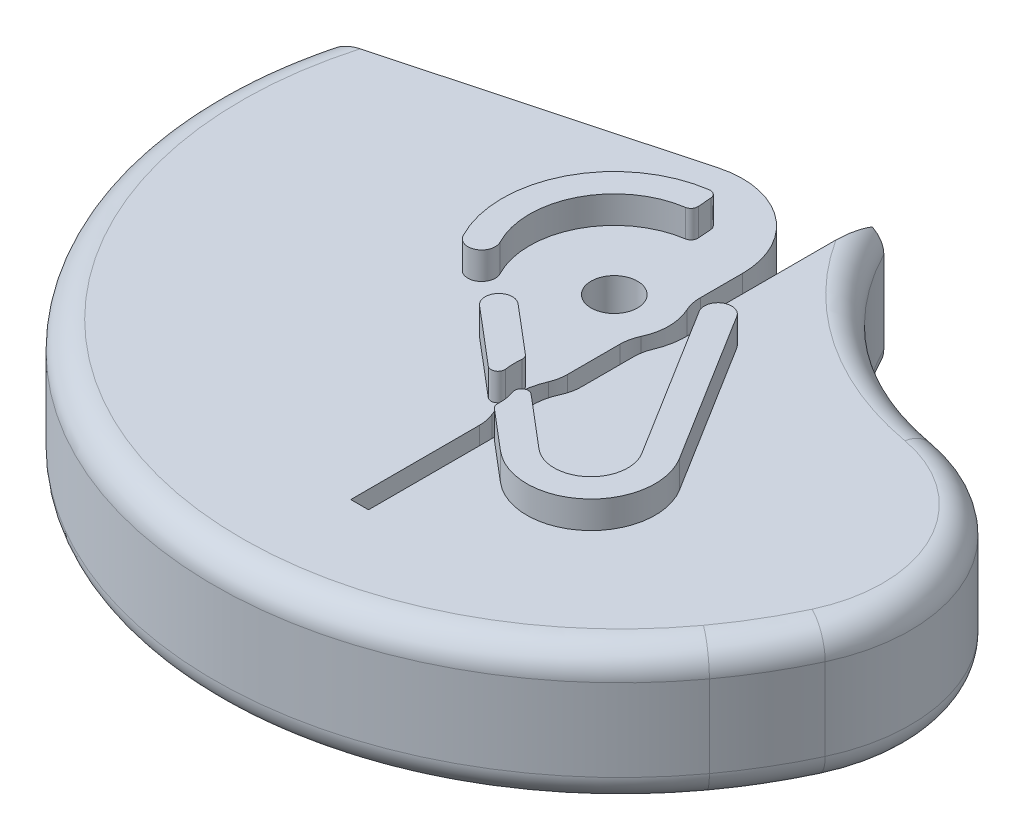
from build123d import *

# Parameters (mm, degrees)
BOSS_EXTRUDE1_DEPTH  = 10
BOSS_EXTRUDE8_START  = -10
BOSS_EXTRUDE8_DEPTH  = 10
BOSS_EXTRUDE11_DEPTH = 10
SKETCH10_R           = 1.7000000000000002
CUT_EXTRUDE1_DEPTH   = 47.34652090502587
SKETCH13_R           = 3.5
CUT_EXTRUDE2_DEPTH   = 5
FILLET11_R           = 12
FILLET1_R            = 2
CUT_EXTRUDE5_DEPTH   = 47.346521064692666
CUT_EXTRUDE6_DEPTH   = 8
FILLET12_R           = 3
BOSS_EXTRUDE12_DEPTH = 2
FILLET16_R           = 0.5
CUT_EXTRUDE8_DEPTH   = 10
FILLET22_R           = 6
FILLET23_ANGLE       = 159.751266


with BuildPart() as part:
    # Sketch1 → Boss-Extrude1 (new body)
    with BuildSketch(Plane(origin=(0, 0, 0), x_dir=(1, 0, 0), z_dir=(0, 1, 0))):
        with BuildLine():
            Line((-29, 3.0000000000000027), (-24, 3.0000000000000027))
            ThreePointArc((-24, 3.0000000000000027), (-9.150757595082503, 9.150757595082506), (-3.0000000000000027, 24.000000000000004))
            Line((-3.0000000000000027, 24.000000000000004), (-2.999999999999995, 28.999999999999996))
            Line((-2.999999999999995, 28.999999999999996), (1.4e-16, 28.999999999999993))
            Line((1.4e-16, 28.999999999999993), (2.999999999999999, 28.999999999999996))
            Line((2.999999999999999, 28.999999999999996), (2.999999999999999, 23.999999999999996))
            ThreePointArc((2.999999999999999, 23.999999999999996), (9.150757595082506, 9.1507575950825), (24.000000000000004, 3))
            Line((24.000000000000004, 3), (28.999999999999996, 2.9999999999999933))
            Line((28.999999999999996, 2.9999999999999933), (28.99999999999999, -3.04e-15))
            Line((28.99999999999999, -3.04e-15), (28.999999999999996, -3.0000000000000013))
            Line((28.999999999999996, -3.0000000000000013), (23.999999999999993, -3.0000000000000018))
            ThreePointArc((23.999999999999993, -3.0000000000000018), (9.150757595082498, -9.150757595082506), (2.999999999999999, -24.000000000000007))
            Line((2.999999999999999, -24.000000000000007), (2.9999999999999933, -29))
            Line((2.9999999999999933, -29), (2.17e-15, -28.999999999999996))
            Line((2.17e-15, -28.999999999999996), (-2.9999999999999947, -29.000000000000007))
            Line((-2.9999999999999947, -29.000000000000007), (-2.9999999999999956, -24.000000000000004))
            ThreePointArc((-2.9999999999999956, -24.000000000000004), (-9.150757595082506, -9.150757595082512), (-24, -3.0000000000000115))
            Line((-24, -3.0000000000000115), (-29, -3.000000000000008))
            Line((-29, -3.000000000000008), (-29, 9e-17))
            Line((-29, 9e-17), (-29, 3.0000000000000027))
        make_face()
    extrude(amount=BOSS_EXTRUDE1_DEPTH)

    # Sketch9 → Boss-Extrude8 (add)
    with BuildSketch(Plane(origin=(0, 10, 0), x_dir=(1, 0, 0), z_dir=(0, 1, 0)).offset(BOSS_EXTRUDE8_START)):
        with BuildLine():
            Line((-4.201010126776677, -31.000000000000007), (2.9999999999999942, -31.000000000000007))
            Line((2.9999999999999942, -31.000000000000007), (2.9999999999999933, -29))
            Line((2.9999999999999933, -29), (-2.9999999999999947, -29.000000000000007))
            Line((-2.9999999999999947, -29.000000000000007), (-3.0000000000000027, -24.000000000000004))
            ThreePointArc((-3.0000000000000027, -24.000000000000004), (-3.3024302472767424, -27.551141553241024), (-4.201010126776677, -31.000000000000007))
        make_face()
        with BuildLine():
            Line((-31.000000000000007, -2.999999999999996), (-29, -2.999999999999995))
            Line((-29, -2.999999999999995), (-29.000000000000007, 2.9999999999999933))
            Line((-29.000000000000007, 2.9999999999999933), (-24.000000000000004, 3.0000000000000013))
            ThreePointArc((-24.000000000000004, 3.0000000000000013), (-27.551141553241024, 3.3024302472767424), (-31.000000000000007, 4.2010101267766755))
            Line((-31.000000000000007, 4.2010101267766755), (-31.000000000000007, -2.999999999999996))
        make_face()
        with BuildLine():
            Line((-2.9999999999999982, 31.000000000000007), (-2.9999999999999973, 29))
            Line((-2.9999999999999973, 29), (2.9999999999999916, 29.000000000000007))
            Line((2.9999999999999916, 29.000000000000007), (2.9999999999999996, 24.000000000000004))
            ThreePointArc((2.9999999999999996, 24.000000000000004), (3.302430247276739, 27.551141553241024), (4.201010126776674, 31.00000000000001))
            Line((4.201010126776674, 31.00000000000001), (-2.9999999999999982, 31.000000000000007))
        make_face()
        with BuildLine():
            Line((31.000000000000007, 3), (29, 2.999999999999999))
            Line((29, 2.999999999999999), (29.000000000000007, -2.99999999999999))
            Line((29.000000000000007, -2.99999999999999), (24.000000000000004, -2.9999999999999982))
            ThreePointArc((24.000000000000004, -2.9999999999999982), (27.551141553241024, -3.3024302472767353), (31.00000000000001, -4.201010126776672))
            Line((31.00000000000001, -4.201010126776672), (31.000000000000007, 3))
        make_face()
    extrude(amount=BOSS_EXTRUDE8_DEPTH)

    # Sketch15 → Boss-Extrude11 (add)
    with BuildSketch(Plane.XZ):
        with BuildLine():
            Line((31.000000000000007, -3), (24.000000000000004, -3))
            ThreePointArc((24.000000000000004, -3), (6.853571800517752, -11.875644347017863), (4.201010126776674, -31.00000000000001))
            Line((4.201010126776674, -31.00000000000001), (4.444888692211387, -31.689792749619734))
            ThreePointArc((4.444888692211387, -31.689792749619734), (-23.13590951240458, 22.107231645636396), (31.859064644147985, -3))
            Line((31.859064644147985, -3), (31.000000000000007, -3))
        make_face()
    extrude(amount=-BOSS_EXTRUDE11_DEPTH)

    # Sketch10 → Cut-Extrude1 (cut, through all)
    with BuildSketch(Plane(origin=(0, 10, 0), x_dir=(1, 0, 0), z_dir=(0, 1, 0))):
        with Locations(Location((0, 0, 0), (0, 0, 270))):
            Circle(SKETCH10_R)
    extrude(amount=-CUT_EXTRUDE1_DEPTH, mode=Mode.SUBTRACT)

    # Sketch13 → Cut-Extrude2 (cut)
    with BuildSketch(Plane.XZ):
        with Locations(Location((0, 0, 0), (0, 0, 270))):
            Circle(SKETCH13_R)
    extrude(amount=-CUT_EXTRUDE2_DEPTH, mode=Mode.SUBTRACT)

    # Fillet11
    fillet11_edges = [part.edges().sort_by_distance(p)[0] for p in [
        (31.859064644147985, 5, -2.9999999999999902),
    ]]
    fillet(fillet11_edges, radius=FILLET11_R)

    # Fillet1
    # the kernel refuses this fillet: 2 mm, written as the material it takes off along each edge
    with BuildSketch(Plane(origin=(2.22e-15, 10, 1.33e-15), x_dir=(0.29179218570712273, 0, -0.9564817407354205), z_dir=(0.9564817407354205, 0, 0.29179218570712273))) as fillet1_piece_1:
        with BuildLine():
            CenterArc((32 - FILLET1_R, -FILLET1_R), FILLET1_R, 0, 90)
            Line((32, -FILLET1_R), (32, 0))
            Line((32, 0), (32 - FILLET1_R, 0))
        make_face()
    fillet1_piece_1_solid = revolve(axis=Axis((2.22e-15, 10, 1.33e-15), (0, 1, 0)), revolution_arc=261.9050258296566, mode=Mode.PRIVATE)
    with BuildSketch(Plane(origin=(2.22e-15, 0, 1.33e-15), x_dir=(0.29179218570712273, 0, -0.9564817407354205), z_dir=(0.9564817407354205, 0, 0.29179218570712273))) as fillet1_piece_2:
        with BuildLine():
            CenterArc((32 - FILLET1_R, FILLET1_R), FILLET1_R, 270, 90)
            Line((32 - FILLET1_R, -2.2e-16), (32, 0))
            Line((32, 0), (32, FILLET1_R))
        make_face()
    fillet1_piece_2_solid = revolve(axis=Axis((2.22e-15, 0, 1.33e-15), (0, 1, 0)), revolution_arc=261.9050258296566, mode=Mode.PRIVATE)
    with BuildSketch(Plane(origin=(23.999999999999996, 10, -23.999999999999996), x_dir=(-0.17826495087308294, 0, 0.9839825238743914), z_dir=(0.9839825238743914, 0, 0.17826495087308294))) as fillet1_piece_3:
        with BuildLine():
            CenterArc((20.999999999999993 + FILLET1_R, FILLET1_R), FILLET1_R, 180, 90)
            Line((20.999999999999993, FILLET1_R), (20.999999999999993, 0))
            Line((20.999999999999993, 0), (20.999999999999993 + FILLET1_R, 0))
        make_face()
    fillet1_piece_3_solid = revolve(axis=Axis((23.999999999999996, 10, -23.999999999999996), (0, -1, 0)), revolution_arc=99.20250624888376, mode=Mode.PRIVATE)
    with BuildSketch(Plane(origin=(24.000000000000327, 0, -23.99999999999994), x_dir=(-0.9428090415820639, 0, -0.3333333333333315), z_dir=(0.3333333333333315, 0, -0.9428090415820639))) as fillet1_piece_4:
        with BuildLine():
            CenterArc((21.000000000000327 + FILLET1_R, FILLET1_R), FILLET1_R, 180, 90.00000000000205)
            Line((21.000000000000327 + FILLET1_R, -2.2e-16), (21.000000000000327, 0))
            Line((21.000000000000327, 0), (21.000000000000252, FILLET1_R))
        make_face()
    fillet1_piece_4_solid = revolve(axis=Axis((24.000000000000327, 0, -23.99999999999994), (0, 1, 0)), revolution_arc=99.20250624888268, mode=Mode.PRIVATE)
    with BuildSketch(Plane(origin=(18.117256620069544, 10, 8.471423288433229), x_dir=(0.17826495095489336, 0, -0.9839825238595701), z_dir=(-0.9839825238595701, 0, -0.17826495095489336))) as fillet1_piece_5:
        with BuildLine():
            CenterArc((12.000000000768473 - FILLET1_R, FILLET1_R), FILLET1_R, 270, 90.00000000000006)
            Line((12.000000000768473 + FILLET1_R * 2.454392245e-10, FILLET1_R), (12.000000000768473, 0))
            Line((12.000000000768473, 0), (12.000000000768473 - FILLET1_R, 0))
        make_face()
    fillet1_piece_5_solid = revolve(axis=Axis((18.117256620069544, 10, 8.471423288433229), (0, -1, 0)), revolution_arc=104.79154184638253, mode=Mode.PRIVATE)
    with BuildSketch(Plane(origin=(18.11725662006955, 0, 8.471423288433234), x_dir=(0.17826495095489273, 0, -0.9839825238595703), z_dir=(-0.9839825238595703, 0, -0.17826495095489273))) as fillet1_piece_6:
        with BuildLine():
            CenterArc((12.00000000076848 - FILLET1_R, -FILLET1_R), FILLET1_R, 0, 89.9999999999998)
            Line((12.00000000076848 - FILLET1_R, 2.2e-16), (12.00000000076848, 0))
            Line((12.00000000076848, 0), (12.00000000076848 + FILLET1_R * 2.45428566359e-10, -FILLET1_R))
        make_face()
    fillet1_piece_6_solid = revolve(axis=Axis((18.11725662006955, 0, 8.471423288433234), (0, -1, 0)), revolution_arc=104.79154184638256, mode=Mode.PRIVATE)
    with BuildSketch(Plane(origin=(4.201010126776674, 0, -31.00000000000001), x_dir=(0, 1, 0), z_dir=(0.3333333333333364, 0, -0.9428090415820624))) as fillet1_piece_7:
        with BuildLine():
            CenterArc((FILLET1_R, -FILLET1_R), FILLET1_R, 90, 89.99999999999997)
            Line((-2.2e-16, -FILLET1_R), (0, 0))
            Line((0, 0), (FILLET1_R, 0))
        make_face()
    fillet1_piece_7_solid = extrude(amount=5.731635696304131, mode=Mode.PRIVATE)
    with BuildSketch(Plane(origin=(4.201010126776674, 10, -31.00000000000001), x_dir=(-0.9428090415820624, 0, -0.3333333333333364), z_dir=(0.3333333333333364, 0, -0.9428090415820624))) as fillet1_piece_8:
        with BuildLine():
            CenterArc((FILLET1_R, -FILLET1_R), FILLET1_R, 90, 90)
            Line((-8.4e-16, -FILLET1_R), (0, 0))
            Line((0, 0), (FILLET1_R, 0))
        make_face()
    fillet1_piece_8_solid = extrude(amount=5.731635696304131, mode=Mode.PRIVATE)
    add([fillet1_piece_1_solid, fillet1_piece_2_solid, fillet1_piece_3_solid, fillet1_piece_4_solid, fillet1_piece_5_solid, fillet1_piece_6_solid, fillet1_piece_7_solid, fillet1_piece_8_solid], mode=Mode.SUBTRACT)

    # Sketch19 → Cut-Extrude5 (cut, through all)
    with BuildSketch(Plane.XZ):
        with BuildLine():
            Line((4.201010126776674, -31.00000000000001), (4.444888692211387, -31.689792749619734))
            ThreePointArc((4.444888692211387, -31.689792749619734), (-29.471415770690026, 12.467383545520837), (25.83733427301488, 18.87941094590854))
            ThreePointArc((25.83733427301488, 18.87941094590854), (-15.73526479770299, 25.348105289077708), (-22.20395914087216, -16.224493781640145))
            ThreePointArc((-22.20395914087216, -16.224493781640145), (-12.451434074131708, -24.519620500683775), (0, -27.5))
            Line((0, -27.5), (3.2937207591513458, -27.5))
            ThreePointArc((3.2937207591513458, -27.5), (3.6718986006846066, -29.269562932459532), (4.201010126776674, -31.00000000000001))
        make_face()
    extrude(amount=-CUT_EXTRUDE5_DEPTH, mode=Mode.SUBTRACT)

    # Sketch21 → Cut-Extrude6 (cut)
    with BuildSketch(Plane(origin=(0, 10, 0), x_dir=(1, 0, 0), z_dir=(0, 1, 0))):
        with BuildLine():
            Line((3.3499999999999996, -2.1857492994394403), (3.3500000000000005, -7.456872004794096))
            ThreePointArc((3.3500000000000005, -7.456872004794096), (2.7, -10.000000000000002), (3.3500000000000014, -12.543127995205907))
            Line((3.3500000000000014, -12.543127995205907), (3.3500000000000014, -22.6319878215018))
            Line((3.3500000000000014, -22.6319878215018), (4.6499999999999995, -22.6319878215018))
            Line((4.6499999999999995, -22.6319878215018), (4.6499999999999995, -12.18574929943944))
            ThreePointArc((4.6499999999999995, -12.18574929943944), (3.999999999999999, -10), (4.65, -7.814250700560559))
            Line((4.65, -7.814250700560559), (4.6499999999999995, -2.5431279952059045))
            ThreePointArc((4.6499999999999995, -2.5431279952059045), (5.3, 0), (4.6499999999999995, 2.5431279952059045))
            Line((4.6499999999999995, 2.5431279952059045), (4.649999999999999, 24.86997922175309))
            Line((4.649999999999999, 24.86997922175309), (3.3499999999999983, 24.86997922175309))
            Line((3.3499999999999983, 24.86997922175309), (3.3499999999999996, 2.1857492994394403))
            ThreePointArc((3.3499999999999996, 2.1857492994394403), (4, 0), (3.3499999999999996, -2.1857492994394403))
        make_face()
    extrude(amount=-CUT_EXTRUDE6_DEPTH, mode=Mode.SUBTRACT)

    # Fillet12
    fillet12_edges = [part.edges().sort_by_distance(p)[0] for p in [
        (3.3499999999999996, 6, -2.1857492994394403),
        (3.3500000000000014, 6, 12.543127995205907),
        (3.35, 6, 7.456872004794096),
        (3.3499999999999996, 6, 2.18574929943944),
        (4.65, 6, -2.543127995205904),
        (4.6499999999999995, 6, 2.5431279952059045),
        (4.65, 6, 7.81425070056056),
        (4.65, 6, 12.18574929943944),
    ]]
    fillet(fillet12_edges, radius=FILLET12_R)

    # Sketch22 → Boss-Extrude12 (add)
    with BuildSketch(Plane(origin=(0, 10, 0), x_dir=(1, 0, 0), z_dir=(0, 1, 0))):
        with BuildLine():
            Line((-0.9410232794524035, -6.097466413975398), (2.7565050622575002, -9.228144548591665))
            ThreePointArc((2.7565050622575002, -9.228144548591665), (2.7420947888784566, -10.66665792642172), (3.1150602409638557, -12.056055337433282))
            ThreePointArc((3.1150602409638557, -12.056055337433282), (3.1441141140573974, -12.127648582033496), (3.1713146449834664, -12.199966293083152))
            Line((3.1713146449834664, -12.199966293083152), (-2.233388905668836, -7.623831733344979))
            ThreePointArc((-2.233388905668836, -7.623831733344979), (-2.3503887522454106, -6.214466260551973), (-0.9410232794524035, -6.097466413975398))
        make_face()
        with BuildLine():
            Line((13.077243434064954, -11.061559301183609), (6.169501164246992, 0.04332281597879976))
            ThreePointArc((6.169501164246992, 0.04332281597879976), (6.490431337307185, 1.420640435128268), (7.867748956456652, 1.0997102620680754))
            Line((7.867748956456652, 1.0997102620680754), (14.775491226274623, -10.005171855094346))
            ThreePointArc((14.775491226274623, -10.005171855094346), (13.856588423584014, -16.044779751040444), (7.747549692973299, -16.074640853922645))
            Line((7.747549692973299, -16.074640853922645), (4.650000000000001, -13.451961539936832))
            Line((4.650000000000001, -13.451961539936832), (4.6499999999999995, -12.945759664331089))
            ThreePointArc((4.6499999999999995, -12.945759664331089), (4.579529460023035, -12.299340958802588), (4.371428571428571, -11.683291236760622))
            ThreePointArc((4.371428571428571, -11.683291236760622), (4.1277844849000065, -11.002969094548227), (4.010519991510903, -10.289912507260095))
            Line((4.010519991510903, -10.289912507260095), (9.039915319189735, -14.548275534553065))
            ThreePointArc((9.039915319189735, -14.548275534553065), (12.549363100604399, -14.531121283961152), (13.077243434064954, -11.061559301183609))
        make_face()
        with BuildLine():
            Line((-0.4741053578997305, 6.18184633500468), (-0.6270425701254502, 8.17599031403845))
            ThreePointArc((-0.6270425701254502, 8.17599031403845), (-7.167153081897932, 3.983957417021553), (-7.2749264719064, -3.7835756670582867))
            ThreePointArc((-7.2749264719064, -3.7835756670582867), (-5.926328650081439, -4.209350155454398), (-5.500554161685327, -2.860752333629438))
            ThreePointArc((-5.500554161685327, -2.860752333629438), (-5.41906696436185, 3.012260486040686), (-0.4741053578997305, 6.18184633500468))
        make_face()
    extrude(amount=BOSS_EXTRUDE12_DEPTH)

    # Fillet16
    # the kernel refuses this fillet: 0.5 mm, written as the material it takes off along each edge
    with BuildSketch(Plane(origin=(4.650000000000001, 10, 13.451961539936832), x_dir=(-7.66e-15, 0, -1), z_dir=(0, 1, 0))) as fillet16_piece_1:
        with BuildLine():
            CenterArc((FILLET16_R * 0.463607476404, -FILLET16_R), FILLET16_R, 89.99999999999957, 49.74558323396275)
            Line((-FILLET16_R * 0.299575183281, -FILLET16_R * 0.353817186892), (0, 0))
            Line((0, 0), (FILLET16_R * 0.463607476404, 0))
        make_face()
    extrude(amount=2.5795093455050413, mode=Mode.SUBTRACT)
    with BuildSketch(Plane(origin=(4.010519991510904, 10, 10.289912507260095), x_dir=(0.7631826596847906, 0, 0.646182813108217), z_dir=(0, 1, 0))) as fillet16_piece_2:
        with BuildLine():
            CenterArc((1.627526423263627, -0.5), FILLET16_R, 90.00000000000003, 150.6993809006728)
            Line((1.3828304859089908, -0.9360319922232039), (1.358360892173527, -0.9796351914455242))
            ThreePointArc((1.358360892173527, -0.9796351914455242), (1.1547971954901433, -0.8755568029870049), (-0.03571706855176803, -0.03498987016363905))
            Line((-0.03571706855176803, -0.03498987016363905), (1.3e-16, 0.04999999999999941))
            Line((1.3e-16, 0.04999999999999941), (1.627526423263627, 0.04999999999999934))
            Line((1.627526423263627, 0.04999999999999934), (1.6275264232636268, -1e-16))
        make_face()
    extrude(amount=6.174607798363095, mode=Mode.SUBTRACT)
    with BuildSketch(Plane(origin=(3.1713146449834664, 10, 12.199966293083152), x_dir=(-0.7631826596847914, 0, -0.6461828131082161), z_dir=(0, 1, 0))) as fillet16_piece_3:
        with BuildLine():
            CenterArc((1.6296066509961113, -0.5), FILLET16_R, 89.99999999999994, 137.8371168074777)
            Line((1.2939863772884717, -0.8706197942317832), (1.2604243499177077, -0.9076817736549612))
            ThreePointArc((1.2604243499177077, -0.9076817736549612), (0.11328825017861112, -0.1180618856839784), (-0.0249023411896119, -0.04335750688492294))
            Line((-0.0249023411896119, -0.04335750688492294), (5.2e-16, 0.0499999999999997))
            Line((5.2e-16, 0.0499999999999997), (1.6296066509961122, 0.04999999999999945))
            Line((1.6296066509961122, 0.04999999999999945), (1.6296066509961118, -1.2e-16))
        make_face()
    extrude(amount=6.0740166274902805, mode=Mode.SUBTRACT)
    with BuildSketch(Plane(origin=(2.7565050622575002, 10, 9.228144548591665), x_dir=(-0.12152264594318536, 0, 0.9925886592758187), z_dir=(0, 1, 0))) as fillet16_piece_4:
        with BuildLine():
            CenterArc((0.27002653512611713, -0.4998520308409607), FILLET16_R, 91.39395560283157, 55.3316145811082)
            Line((-0.14799961395938357, -0.22552715285730596), (0, 0))
            ThreePointArc((0, 0), (0.12893158884399894, -0.00156847308581748), (0.25786317768800077, 0))
        make_face()
    extrude(amount=2.674381116320962, mode=Mode.SUBTRACT)
    with BuildSketch(Plane(origin=(-0.4741053578997304, 10, -6.18184633500468), x_dir=(-0.9935213727873651, 0, 0.11364542144191084), z_dir=(0, 1, 0))) as fillet16_piece_5:
        with BuildLine():
            CenterArc((0.48167918797674125, -0.4996513193807079), FILLET16_R, 92.1398916001386, 85.7202168003903)
            Line((-0.01797213140418375, -0.4809815834184401), (0, 0))
            ThreePointArc((0, 0), (0.23150472600432587, -0.00432363967922732), (0.46300945200865257, 0))
        make_face()
    extrude(amount=3.2032930885047257, mode=Mode.SUBTRACT)
    with BuildSketch(Plane(origin=(-0.6270425701254502, 10, -8.175990314038447), x_dir=(-0.9940617104867051, 0, 0.10881780986697823), z_dir=(0, 1, 0))) as fillet16_piece_6:
        with BuildLine():
            CenterArc((0.5165063609269088, 0.49973611680915875), FILLET16_R, 178.13843761978944, 93.72312476053929)
            Line((0.01677024411771667, 0.5159784552020568), (0, 0))
            ThreePointArc((0, 0), (0.2663743496604189, -0.0043276843297979), (0.5327486993208375, 0))
        make_face()
    extrude(amount=3.3318717483020936, mode=Mode.SUBTRACT)

    # Sketch23 → Cut-Extrude8 (cut)
    with BuildSketch(Plane(origin=(0, 10, 0), x_dir=(1, 0, 0), z_dir=(0, 1, 0))):
        Polygon((-35.208639317578275, 3.4963660888875325), (-29.021625360860476, 30.46425239543553), (4.774185082510891, 30.46425239543553), (11.635853203273454, 16.101549593024345), align=None)
    extrude(amount=-CUT_EXTRUDE8_DEPTH, mode=Mode.SUBTRACT)

    # Fillet22
    fillet22_edges = [part.edges().sort_by_distance(p)[0] for p in [
        (3.3499999999999983, 6, -13.87194490536313),
    ]]
    fillet(fillet22_edges, radius=FILLET22_R)

    # Fillet23: read off the stored shape, not the designer's step
    # Fillet23 outline → Fillet23 (revolve, cut)
    with BuildSketch(Plane(origin=(1.816687566, 0, 1.327458582), x_dir=(-0.9617079846837564, 0, -0.2740761795477815), z_dir=(0.2740761795477815, 0, -0.9617079846837564))):
        with BuildLine():
            Line((29.75, 0), (29.75, 2))
            ThreePointArc((29.75, 2), (29.164213562, 0.585786438), (27.75, 0))
            Line((27.75, 0), (29.75, 0))
        make_face()
        with BuildLine():
            ThreePointArc((27.75, 10), (29.164213562, 9.414213562), (29.75, 8))
            Line((29.75, 8), (29.75, 10))
            Line((29.75, 10), (27.75, 10))
        make_face()
    revolve(axis=Axis((1.816687566, 0, 1.327458582), (0, 1, 0)), revolution_arc=FILLET23_ANGLE, mode=Mode.SUBTRACT)


solid = part.part
